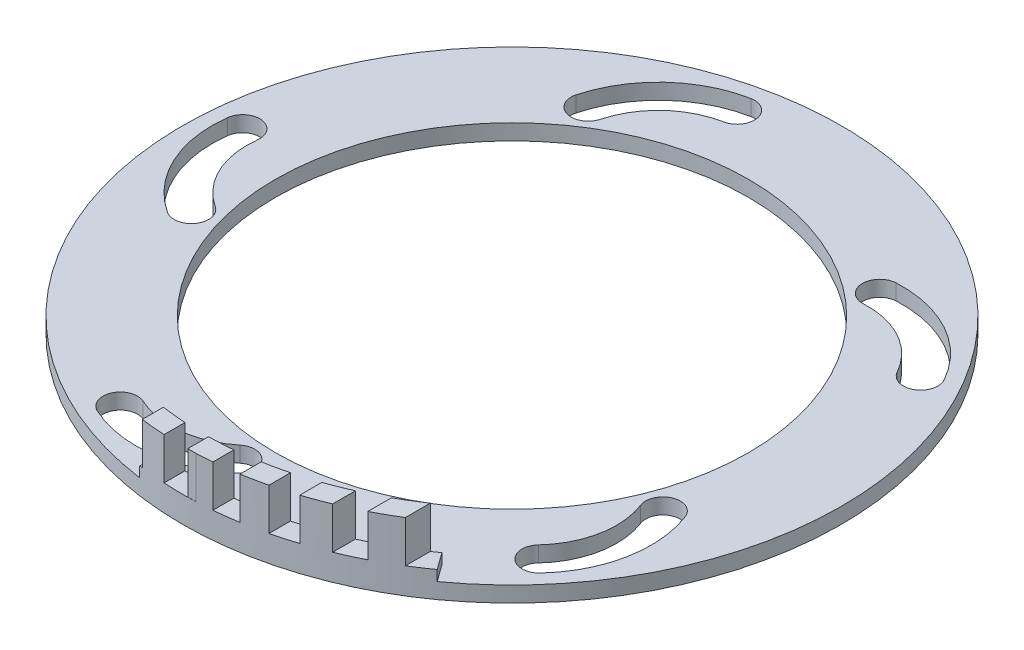
from build123d import *

# Parameters (mm, degrees)
SKETCH1_R           = 31.5
SKETCH1_R_2         = 22.625
BOSS_EXTRUDE1_DEPTH = 1.5
BOSS_EXTRUDE2_DEPTH = 5
SKETCH5_OUTSIDE_W   = 82.866
SKETCH5_OUTSIDE_H   = 82.866
SKETCH5_OUTSIDE_W_2 = 2.3
SKETCH5_OUTSIDE_H_2 = 2.235788696
SKETCH5_OUTSIDE_H_3 = 6
SKETCH5_OUTSIDE_H_4 = 9.066972397
SKETCH5_OUTSIDE_H_5 = 8.526406287
CUT_EXTRUDE10_DEPTH = 4


with BuildPart() as part:
    # Sketch1 → Boss-Extrude1 (new body)
    with BuildSketch(Plane(origin=(0, 0, 0), x_dir=(1, 0, 0), z_dir=(0, 1, 0))):
        Circle(SKETCH1_R)
        with BuildLine():
            ThreePointArc((-10.567211754, -24.68672042), (-6.292703266, -25.370596148), (-2.305786299, -23.684297857))
            ThreePointArc((-2.305786299, -23.684297857), (0.01460205, -23.930870181), (-0.231970274, -26.251258529))
            ThreePointArc((-0.231970274, -26.251258529), (-5.895204242, -28.646568451), (-11.966948868, -27.675154125))
            ThreePointArc((-11.966948868, -27.675154125), (-12.761297164, -25.481068715), (-10.567211754, -24.68672042))
        make_face(mode=Mode.SUBTRACT)
        with BuildLine():
            ThreePointArc((-26.743914336, 2.421399453), (-26.073423039, -1.855228921), (-23.237632962, -5.125917453))
            ThreePointArc((-23.237632962, -5.125917453), (-22.755097744, -7.408932951), (-25.038113242, -7.891468169))
            ThreePointArc((-25.038113242, -7.891468169), (-29.066223891, -3.245604073), (-30.018626241, 2.829151754))
            ThreePointArc((-30.018626241, 2.829151754), (-28.177394138, 4.262631556), (-26.743914336, 2.421399453))
        make_face(mode=Mode.SUBTRACT)
        with BuildLine():
            ThreePointArc((20.213018306, -17.678631743), (22.18431854, -13.824661813), (21.812578659, -9.511783622))
            ThreePointArc((21.812578659, -9.511783622), (22.764122308, -7.381158201), (24.894747729, -8.33270185))
            ThreePointArc((24.894747729, -8.33270185), (25.422787299, -14.458948891), (22.622645099, -19.933337648))
            ThreePointArc((22.622645099, -19.933337648), (20.29047875, -20.010798092), (20.213018306, -17.678631743))
        make_face(mode=Mode.SUBTRACT)
        with BuildLine():
            ThreePointArc((-12.05586069, 20.516306647), (-14.078025873, 19.351897797), (-15.242434724, 21.37406298))
            ThreePointArc((-15.242434724, 21.37406298), (-12.068710047, 26.64067482), (-6.585582445, 29.423666069))
            ThreePointArc((-6.585582445, 29.423666069), (-4.653290128, 28.115519899), (-5.961436298, 26.183227582))
            ThreePointArc((-5.961436298, 26.183227582), (-9.821558376, 24.224001618), (-12.05586069, 20.516306647))
        make_face(mode=Mode.SUBTRACT)
        Circle(SKETCH1_R_2, mode=Mode.SUBTRACT)
        with BuildLine():
            ThreePointArc((23.059544082, 13.760725128), (20.00336614, 16.826485265), (15.786701292, 17.805692285))
            ThreePointArc((15.786701292, 17.805692285), (14.05439926, 19.369063536), (15.617770512, 21.101365568))
            ThreePointArc((15.617770512, 21.101365568), (21.607350881, 19.710446595), (25.948512455, 15.35567395))
            ThreePointArc((25.948512455, 15.35567395), (25.301502679, 13.113715353), (23.059544082, 13.760725128))
        make_face(mode=Mode.SUBTRACT)
    extrude(amount=BOSS_EXTRUDE1_DEPTH)

    # Sketch2 → Boss-Extrude2 (add)
    with BuildSketch(Plane(origin=(0, 1.5, 0), x_dir=(1, 0, 0), z_dir=(0, 1, 0))):
        with BuildLine():
            Line((-4.111485424, -29.212081193), (-4.390230198, -31.192561274))
            ThreePointArc((-4.390230198, -31.192561274), (7.554963543, -30.580590672), (18.410886017, -25.559524175))
            Line((18.410886017, -25.559524175), (17.241940873, -23.936697244))
            ThreePointArc((17.241940873, -23.936697244), (7.075283318, -28.638965868), (-4.111485424, -29.212081193))
        make_face()
    extrude(amount=BOSS_EXTRUDE2_DEPTH)

    # Sketch5 outside → Cut-Extrude10 (cut)
    with BuildSketch(Plane(origin=(0, 6.5, 0), x_dir=(1, 0, 0), z_dir=(0, 1, 0))):
        Rectangle(SKETCH5_OUTSIDE_W, SKETCH5_OUTSIDE_H)
        with Locations((-2.961485424, -30.329975541)):
            Rectangle(SKETCH5_OUTSIDE_W_2, SKETCH5_OUTSIDE_H_2, mode=Mode.SUBTRACT)
        with Locations((1.638514576, -28.474302668)):
            Rectangle(SKETCH5_OUTSIDE_W_2, SKETCH5_OUTSIDE_H_3, mode=Mode.SUBTRACT)
        with Locations((6.238514576, -28.474302668)):
            Rectangle(SKETCH5_OUTSIDE_W_2, SKETCH5_OUTSIDE_H_3, mode=Mode.SUBTRACT)
        with Locations((10.838514576, -28.252340763)):
            Rectangle(SKETCH5_OUTSIDE_W_2, SKETCH5_OUTSIDE_H_4, mode=Mode.SUBTRACT)
        with Locations((15.438514576, -26.892833744)):
            Rectangle(SKETCH5_OUTSIDE_W_2, SKETCH5_OUTSIDE_H_5, mode=Mode.SUBTRACT)
    extrude(amount=-CUT_EXTRUDE10_DEPTH, mode=Mode.SUBTRACT)


solid = part.part
